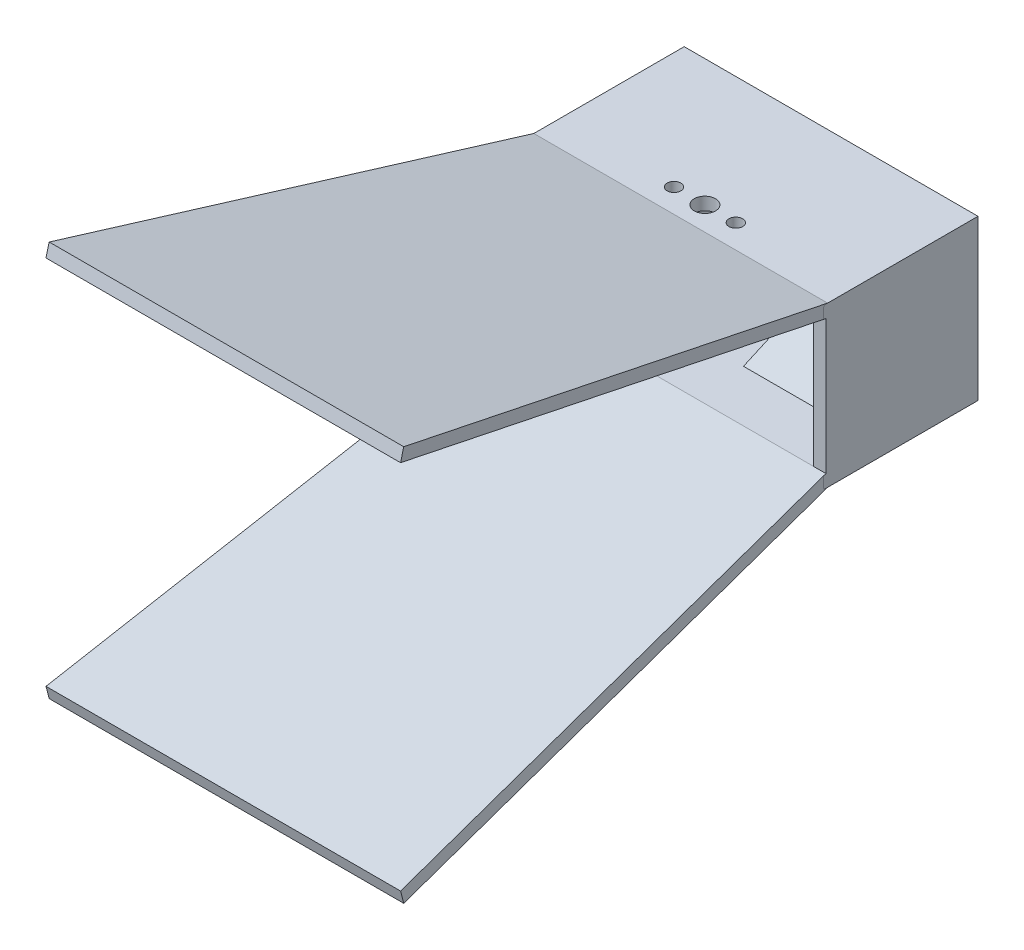
from build123d import *

# Parameters (mm, degrees)
CROQUIS1_W                   = 53
CROQUIS1_H                   = 26.5
SALIENTE_EXTRUIR1_DEPTH      = 14.8
CROQUIS8_W                   = 5
CROQUIS8_H                   = 26.5
CORTAR_EXTRUIR2_DEPTH        = 14.8
SALIENTE_EXTRUIR2_DEPTH      = 35
SALIENTE_EXTRUIR2_DEPTH_BACK = 35
CROQUIS12_W                  = 2.5
CROQUIS12_H                  = 26.5
SALIENTE_EXTRUIR3_DEPTH      = 25
CROQUIS13_W                  = 6
CROQUIS13_H                  = 29.680771502
CORTAR_EXTRUIR3_DEPTH        = 31.5
CORTAR_EXTRUIR13_DEPTH       = 2.5
CORTAR_EXTRUIR14_DEPTH       = 2.5
CROQUIS17_W                  = 6
CROQUIS17_H                  = 31.5
CORTAR_EXTRUIR11_DEPTH       = 30.5
CROQUIS18_R                  = 2.1
CROQUIS18_R_2                = 1.35
CORTAR_EXTRUIR12_DEPTH       = 2.5


with BuildPart() as part:
    # Croquis1 → Saliente-Extruir1 (new body)
    with BuildSketch(Plane.XY):
        Rectangle(CROQUIS1_W, CROQUIS1_H)
    extrude(amount=SALIENTE_EXTRUIR1_DEPTH)

    # Croquis5 → Cortar-Recubrir3 section 0
    with BuildSketch(Plane.XY.offset(14.8)):
        with BuildLine():
            Line((-26.5, 13.25), (-26.5, -13.25))
            Line((-26.5, -13.25), (26.5, -13.25))
            Line((26.5, -13.25), (26.5, 13.25))
            Line((26.5, 13.25), (-26.5, 13.25))
        make_face()
    # Croquis6 → Cortar-Recubrir3 section 1
    with BuildSketch(Plane(origin=(0, 0, 0), x_dir=(-1, 0, 0), z_dir=(0, 0, -1))):
        with BuildLine():
            Line((-13.25, -6.625), (13.25, -6.625))
            Line((13.25, -6.625), (13.25, 6.625))
            Line((13.25, 6.625), (-13.25, 6.625))
            Line((-13.25, 6.625), (-13.25, -6.625))
        make_face()
    loft(mode=Mode.SUBTRACT)

    # Croquis8 → Cortar-Extruir2 (cut)
    with BuildSketch(Plane(origin=(0, 0, 0), x_dir=(-1, 0, 0), z_dir=(0, 0, -1))):
        Rectangle(CROQUIS8_W, CROQUIS8_H)
    extrude(amount=-CORTAR_EXTRUIR2_DEPTH, mode=Mode.SUBTRACT)


with BuildPart() as cortar_extruir2_piece_1:
    # of the separate pieces the step leaves, piece 1, a body of its own (cortar_extruir2_pieces)
    add(part.part.solids().sort_by_distance((-26.5, -13.25, 0))[0])



with BuildPart() as cortar_extruir2_piece_2:
    # of the separate pieces the step leaves, piece 2, a body of its own (cortar_extruir2_pieces)
    add(part.part.solids().sort_by_distance((2.5, -13.25, 0))[0])


with BuildPart() as cortar_extruir2_piece_1_1:
    add(cortar_extruir2_piece_1.part)

    add(cortar_extruir2_piece_2.part)  # Saliente-Extruir2 merges Cortar-Extruir2 piece 2
    # Croquis10 → Saliente-Extruir2 (add, two sides: drawn at the far end of the back side and taken through both)
    with BuildSketch(Plane(origin=(0, 0, 0), x_dir=(0, 0, -1), z_dir=(1, 0, 0)).offset(-SALIENTE_EXTRUIR2_DEPTH_BACK)):
        Polygon((-14.8, 13.25), (-25, 13.25), (-115, 36.615427319), (-114.371786091, 39.035209806), (-24.680771502, 15.75), (5, 15.75), (5, 15), (5, -15.75), (-24.680771502, -15.75), (-114.371786091, -39.035209806), (-115, -36.615427319), (-25, -13.25), (-14.8, -13.25), (0, -13.25), (0, 13.25), align=None)
    extrude(amount=SALIENTE_EXTRUIR2_DEPTH + SALIENTE_EXTRUIR2_DEPTH_BACK)

    # Croquis12 → Saliente-Extruir3 (add)
    with BuildSketch(Plane.XY):
        with Locations((-27.75, 0)):
            Rectangle(CROQUIS12_W, CROQUIS12_H)
        with Locations((27.75, 0)):
            Rectangle(CROQUIS12_W, CROQUIS12_H)
    extrude(amount=SALIENTE_EXTRUIR3_DEPTH)

    # Croquis13 → Cortar-Extruir3 (cut)
    with BuildSketch(Plane(origin=(0, 15.75, 0), x_dir=(1, 0, 0), z_dir=(0, 1, 0))):
        with Locations((-32, -9.840385751)):
            Rectangle(CROQUIS13_W, CROQUIS13_H)
        with Locations((32, -9.840385751)):
            Rectangle(CROQUIS13_W, CROQUIS13_H)
    extrude(amount=-CORTAR_EXTRUIR3_DEPTH, mode=Mode.SUBTRACT)

    # Croquis14 → Cortar-Extruir13 (cut)
    with BuildSketch(Plane(origin=(0, 8.752554668, -2.272301999), x_dir=(1, 0, 0), z_dir=(0, 0.9679129947926777, -0.25128556367501503))):
        Polygon((35, -27.846587086), (29, -27.846587086), (35, -120.510922694), align=None)
        Polygon((-35, -27.846587086), (-35, -120.510922694), (-29, -27.846587086), align=None)
    extrude(amount=-CORTAR_EXTRUIR13_DEPTH, mode=Mode.SUBTRACT)

    # Croquis16 → Cortar-Extruir14 (cut)
    with BuildSketch(Plane(origin=(0, -8.752554668, -2.272301999), x_dir=(1, 0, 0), z_dir=(0, -0.9679129947926624, -0.25128556367507404))):
        Polygon((-35, 27.846587086), (-29, 27.846587086), (-35, 120.510922694), align=None)
        Polygon((35, 27.846587086), (35, 120.510922694), (29, 27.846587086), align=None)
    extrude(amount=-CORTAR_EXTRUIR14_DEPTH, mode=Mode.SUBTRACT)

    # Croquis17 → Cortar-Extruir11 (cut)
    with BuildSketch(Plane(origin=(0, 0, -5), x_dir=(-1, 0, 0), z_dir=(0, 0, -1))):
        with Locations((-32, 0)):
            Rectangle(CROQUIS17_W, CROQUIS17_H)
        with Locations((32, 0)):
            Rectangle(CROQUIS17_W, CROQUIS17_H)
    extrude(amount=-CORTAR_EXTRUIR11_DEPTH, mode=Mode.SUBTRACT)

    # Croquis18 → Cortar-Extruir12 (cut)
    with BuildSketch(Plane(origin=(0, 15.75, 0), x_dir=(1, 0, 0), z_dir=(0, 1, 0))):
        with Locations((0.081355667, -19.999867625)):
            Circle(CROQUIS18_R)
        with Locations((6.181355666, -20)):
            Circle(CROQUIS18_R_2)
        with Locations((-6.018644331, -20)):
            Circle(CROQUIS18_R_2)
    extrude(amount=-CORTAR_EXTRUIR12_DEPTH, mode=Mode.SUBTRACT)


solid = cortar_extruir2_piece_1_1.part
